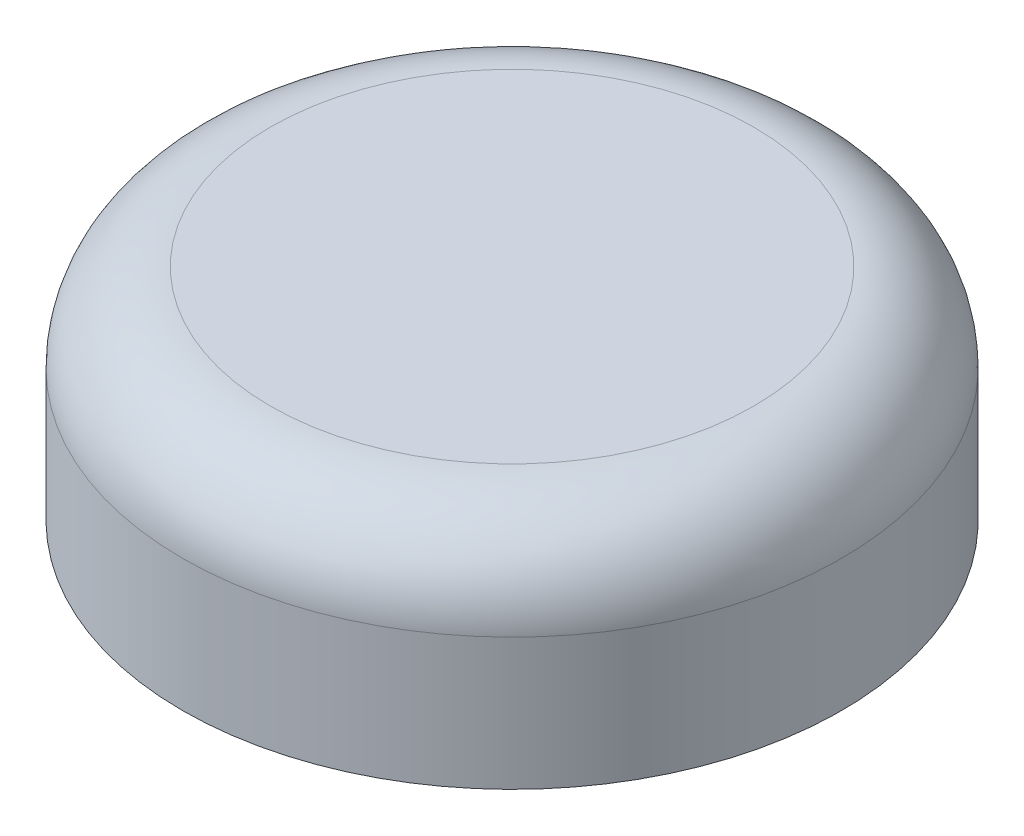
from build123d import *

# Parameters (mm, degrees)
SKETCH1_R           = 9.525
BOSS_EXTRUDE1_DEPTH = 6.35
SKETCH2_R           = 3.175
CUT_EXTRUDE1_DEPTH  = 3.175
FILLET1_R           = 2.54


with BuildPart() as part:
    # Sketch1 → Boss-Extrude1 (new body)
    with BuildSketch(Plane(origin=(0, 0, 0), x_dir=(1, 0, 0), z_dir=(0, 1, 0))):
        Circle(SKETCH1_R)
    extrude(amount=BOSS_EXTRUDE1_DEPTH)

    # Sketch2 → Cut-Extrude1 (cut)
    with BuildSketch(Plane.XZ):
        Circle(SKETCH2_R)
    extrude(amount=-CUT_EXTRUDE1_DEPTH, mode=Mode.SUBTRACT)

    # Fillet1
    fillet1_edges = [part.edges().sort_by_distance(p)[0] for p in [
        (-9.525, 6.35, 0),
    ]]
    fillet(fillet1_edges, radius=FILLET1_R)


solid = part.part
